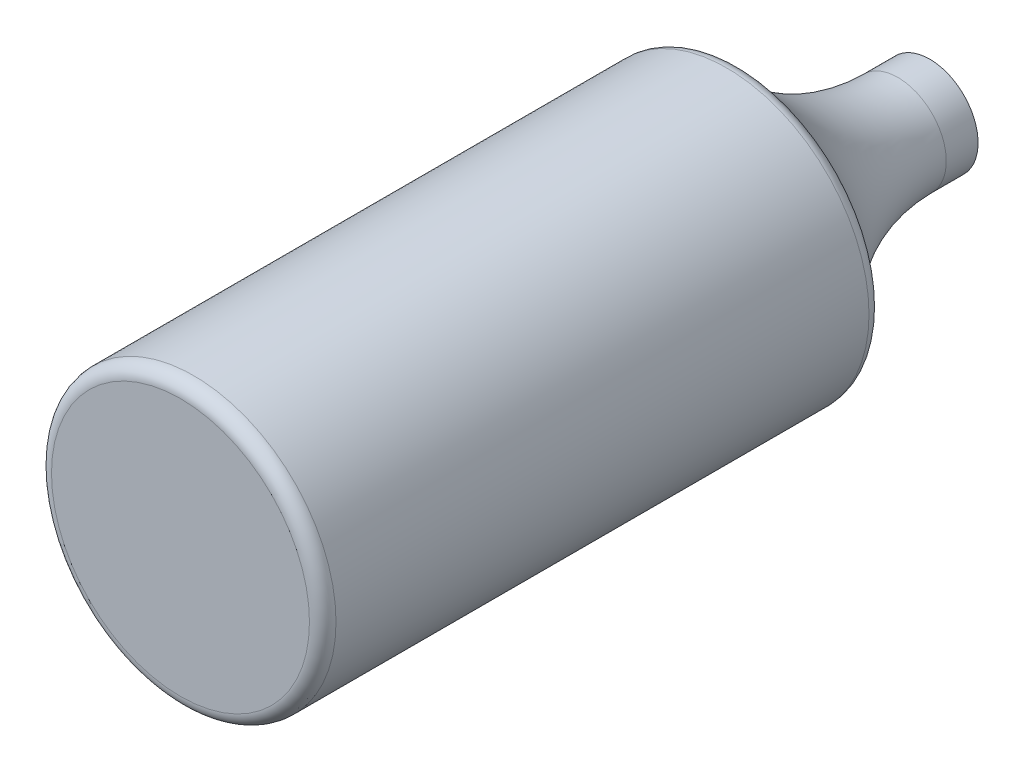
from build123d import *

# Parameters (mm, degrees)
SKETCH1_R           = 7.5
BOSS_EXTRUDE1_DEPTH = 29.5
SKETCH2_R           = 2.55
BOSS_EXTRUDE2_DEPTH = 10
FILLET1_R           = 0.7
FILLET2_R           = 10


with BuildPart() as part:
    # Sketch1 → Boss-Extrude1 (new body)
    with BuildSketch(Plane.XY):
        with Locations(Location((0, 0, 0), (0, 0, 180))):
            Circle(SKETCH1_R)
    extrude(amount=BOSS_EXTRUDE1_DEPTH)

    # Sketch2 → Boss-Extrude2 (add)
    with BuildSketch(Plane(origin=(0, 0, 0), x_dir=(-1, 0, 0), z_dir=(0, 0, -1))):
        Circle(SKETCH2_R)
    extrude(amount=BOSS_EXTRUDE2_DEPTH)

    # Fillet1
    fillet1_edges = [part.edges().sort_by_distance(p)[0] for p in [
        (7.5, 0, 0),
        (7.5, 0, 29.5),
    ]]
    fillet(fillet1_edges, radius=FILLET1_R)

    # Fillet2
    fillet2_edges = [part.edges().sort_by_distance(p)[0] for p in [
        (2.55, 0, 0),
    ]]
    fillet(fillet2_edges, radius=FILLET2_R - 0.0001)  # a hair under: the kernel refuses the full size


solid = part.part
